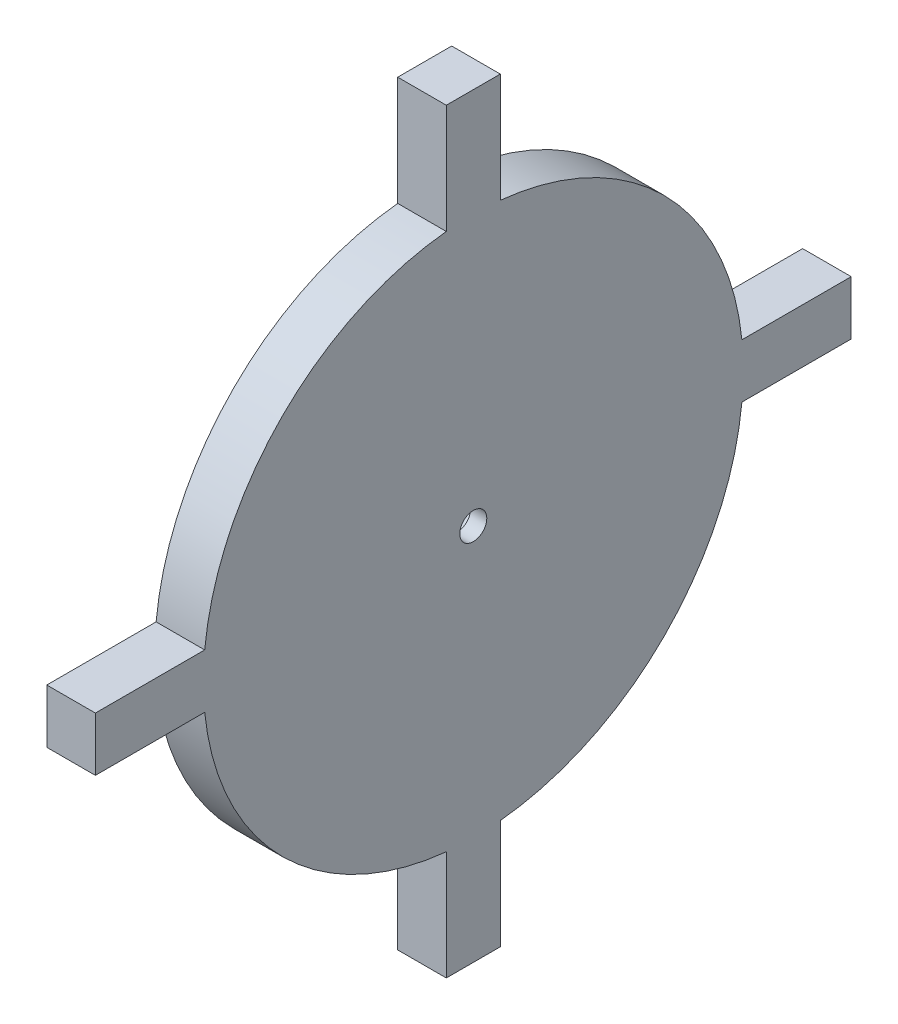
from build123d import *

# Parameters (mm, degrees)
SKETCH1_R           = 3.175
BOSS_EXTRUDE1_DEPTH = 11.43
SKETCH2_R           = 9.776464607
CUT_EXTRUDE1_DEPTH  = 7.62


with BuildPart() as part:
    # Sketch1 → Boss-Extrude1 (new body)
    with BuildSketch(Plane(origin=(0, 0, 0), x_dir=(0, 0, -1), z_dir=(1, 0, 0))):
        with BuildLine():
            Line((6.35, 88.9), (-6.35, 88.9))
            Line((-6.35, 88.9), (-6.35, 63.181702256))
            ThreePointArc((-6.35, 63.181702256), (-44.901280605, 44.901280605), (-63.181702256, 6.35))
            Line((-63.181702256, 6.35), (-88.9, 6.35))
            Line((-88.9, 6.35), (-88.9, -6.35))
            Line((-88.9, -6.35), (-63.181702256, -6.35))
            ThreePointArc((-63.181702256, -6.35), (-44.901280605, -44.901280605), (-6.35, -63.181702256))
            Line((-6.35, -63.181702256), (-6.35, -88.9))
            Line((-6.35, -88.9), (6.35, -88.9))
            Line((6.35, -88.9), (6.35, -63.181702256))
            ThreePointArc((6.35, -63.181702256), (44.901280605, -44.901280605), (63.181702256, -6.35))
            Line((63.181702256, -6.35), (88.9, -6.35))
            Line((88.9, -6.35), (88.9, 6.35))
            Line((88.9, 6.35), (63.181702256, 6.35))
            ThreePointArc((63.181702256, 6.35), (44.901280605, 44.901280605), (6.35, 63.181702256))
            Line((6.35, 63.181702256), (6.35, 88.9))
        make_face()
        Circle(SKETCH1_R, mode=Mode.SUBTRACT)
    extrude(amount=BOSS_EXTRUDE1_DEPTH)

    # Sketch2 → Cut-Extrude1 (cut)
    with BuildSketch(Plane.ZY):
        Circle(SKETCH2_R)
    extrude(amount=-CUT_EXTRUDE1_DEPTH, mode=Mode.SUBTRACT)


solid = part.part
